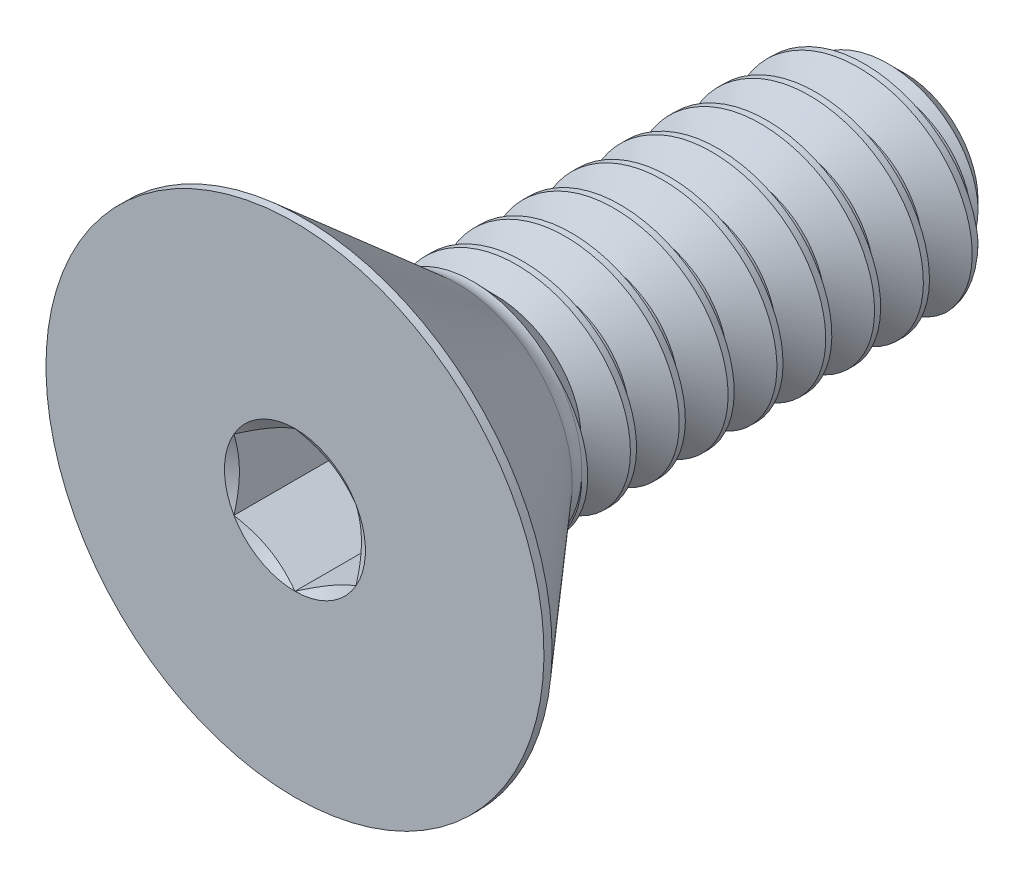
from build123d import *
from build123d.topology import SkipClean

# Parameters (mm, degrees)
SKETCH1_W          = 7.9375
SKETCH1_H          = 1.4224
CHAMFER1_SIZE      = 0.47625
CUT_SWEEP1_PITCH   = 0.635
CUT_EXTRUDE2_DEPTH = 1.47574


with BuildPart() as part:
    # Sketch1 → Revolve1 (revolve)
    with BuildSketch(Plane(origin=(0, 0, 0), x_dir=(0, 0, -1), z_dir=(1, 0, 0)), mode=Mode.PRIVATE) as revolve1_sk:
        with Locations((3.96875, 0.7112)):
            Rectangle(SKETCH1_W, SKETCH1_H)
    revolve(revolve1_sk.sketch.rotate(Axis((0, 0, -7.9375), (0, 0, 1)), 90), axis=Axis((0, 0, -7.9375), (0, 0, 1)))

    # Chamfer1
    chamfer1_edges = [part.edges().sort_by_distance(p)[0] for p in [
        (1.4224, 0, -7.9375),
    ]]
    chamfer(chamfer1_edges, length=CHAMFER1_SIZE)

    # Cut-Sweep1: the profile of Sketch2 profile screwed along a right-hand helix of 12.5 turns, 6 arcs to a turn; built about Z, then put on its axis
    with SkipClean():  # the faces are left unmerged after this step: merging them gives an invalid solid
        cut_sweep1_z = Axis((0, 0, 0), (0, 0, 1))
        cut_sweep1_corners = [(1.423, 0, 0.00034641), (1.423, 0, -0.55597141), (1.009955401, 0, -0.3175), (1.009955401, 0, -0.238125)]
        with BuildLine(mode=Mode.PRIVATE) as cut_sweep1_profile:
            Line(cut_sweep1_corners[0], cut_sweep1_corners[1])
            Line(cut_sweep1_corners[1], cut_sweep1_corners[2])
            Line(cut_sweep1_corners[2], cut_sweep1_corners[3])
            Line(cut_sweep1_corners[3], cut_sweep1_corners[0])
        cut_sweep1_cap = Face(cut_sweep1_profile.wire())
        cut_sweep1_turn_angles = [0, 30, 60, 90, 120, 150, 180, 210, 240, 270, 300, 330, 360]
        cut_sweep1_turn_weights = [1, 0.8660254037844387, 1, 0.8660254037844387, 1, 0.8660254037844387, 1, 0.8660254037844387, 1, 0.8660254037844387, 1, 0.8660254037844387, 1]
        cut_sweep1_turn_rails = [Edge.make_bspline([Vector(p[0], p[1], 0).rotate(cut_sweep1_z, cut_sweep1_turn_angles[k]) / cut_sweep1_turn_weights[k] + Vector(0, 0, p[2] + CUT_SWEEP1_PITCH * cut_sweep1_turn_angles[k] / 360) for k in range(13)], [0, 0, 0, 1, 1, 2, 2, 3, 3, 4, 4, 5, 5, 6, 6, 6], 2, cut_sweep1_turn_weights) for p in cut_sweep1_corners]
        cut_sweep1_turn_sides = [Face.make_surface_from_curves(cut_sweep1_turn_rails[p[0]], cut_sweep1_turn_rails[p[1]]) for p in [(0, 1), (1, 2), (2, 3), (3, 0)]]
        cut_sweep1_last_angles = [4320, 4350, 4380, 4410, 4440, 4470, 4500]
        cut_sweep1_last_weights = [1, 0.8660254037844387, 1, 0.8660254037844387, 1, 0.8660254037843593, 1]
        cut_sweep1_last_rails = [Edge.make_bspline([Vector(p[0], p[1], 0).rotate(cut_sweep1_z, cut_sweep1_last_angles[k]) / cut_sweep1_last_weights[k] + Vector(0, 0, p[2] + CUT_SWEEP1_PITCH * cut_sweep1_last_angles[k] / 360) for k in range(7)], [0, 0, 0, 1, 1, 2, 2, 3, 3, 3], 2, cut_sweep1_last_weights) for p in cut_sweep1_corners]
        cut_sweep1_last_sides = [Face.make_surface_from_curves(cut_sweep1_last_rails[p[0]], cut_sweep1_last_rails[p[1]]) for p in [(0, 1), (1, 2), (2, 3), (3, 0)]]
        cut_sweep1 = Plane(origin=(0, 0, -7.9375), x_dir=(0, 1, 0), z_dir=(0, 0, 1)) * Solid(Shell([*[p.moved(Location((0, 0, CUT_SWEEP1_PITCH * i))) for i in range(12) for p in cut_sweep1_turn_sides], *cut_sweep1_last_sides, cut_sweep1_cap, cut_sweep1_cap.rotate(cut_sweep1_z, 4500).moved(Location((0, 0, CUT_SWEEP1_PITCH * 4500 / 360)))]))
        add(cut_sweep1, mode=Mode.SUBTRACT)

    # Sketch7 → Revolve2 (revolve)
    with BuildSketch(Plane(origin=(0, 0, 0), x_dir=(0, 0, -1), z_dir=(1, 0, 0)), mode=Mode.PRIVATE) as revolve2_sk:
        with BuildLine():
            Line((0, 3.2385), (0.10541, 3.2385))
            Line((0.10541, 3.2385), (2.1082, 1.497501214))
            ThreePointArc((2.1082, 1.497501214), (2.201843405, 1.441789243), (2.309067322, 1.4224))
            Line((2.309067322, 1.4224), (2.309067322, 0))
            Line((2.309067322, 0), (0, 0))
            Line((0, 0), (0, 3.2385))
        make_face()
    revolve(revolve2_sk.sketch.rotate(Axis((0, 0, 0), (0, 0, -1)), 180), axis=Axis((0, 0, 0), (0, 0, -1)))

    # Boss-Extrude1 cone 1 section (through the dimple's axis) → Boss-Extrude1 (revolve)
    with BuildSketch(Plane(origin=(0, 0, -2.309067322), x_dir=(0, -1, 0), z_dir=(1, 0, 0))):
        Polygon((0, 0), (1.4224, 0), (0, 1.373595713), align=None)
    revolve(axis=Axis((0, 0, -2.309067322), (0, 0, -1)))

    # Sketch5 → Cut-Extrude2 (cut)
    with BuildSketch(Plane.XY):
        Polygon((0, 0.916543552), (-0.79375, 0.458271776), (-0.79375, -0.458271776), (0, -0.916543552), (0.79375, -0.458271776), (0.79375, 0.458271776), align=None)
    extrude(amount=-CUT_EXTRUDE2_DEPTH, mode=Mode.SUBTRACT)

    # Cut-Extrude3 cone 1 section (through the dimple's axis) → Cut-Extrude3 (revolve, cut)
    with BuildSketch(Plane(origin=(0, 0, 0), x_dir=(0, -1, 0), z_dir=(1, 0, 0))):
        Polygon((0, 0), (0.916543552, 0), (0, 0.529166667), align=None)
    revolve(axis=Axis((0, 0, 0), (0, 0, -1)), mode=Mode.SUBTRACT)


solid = part.part
